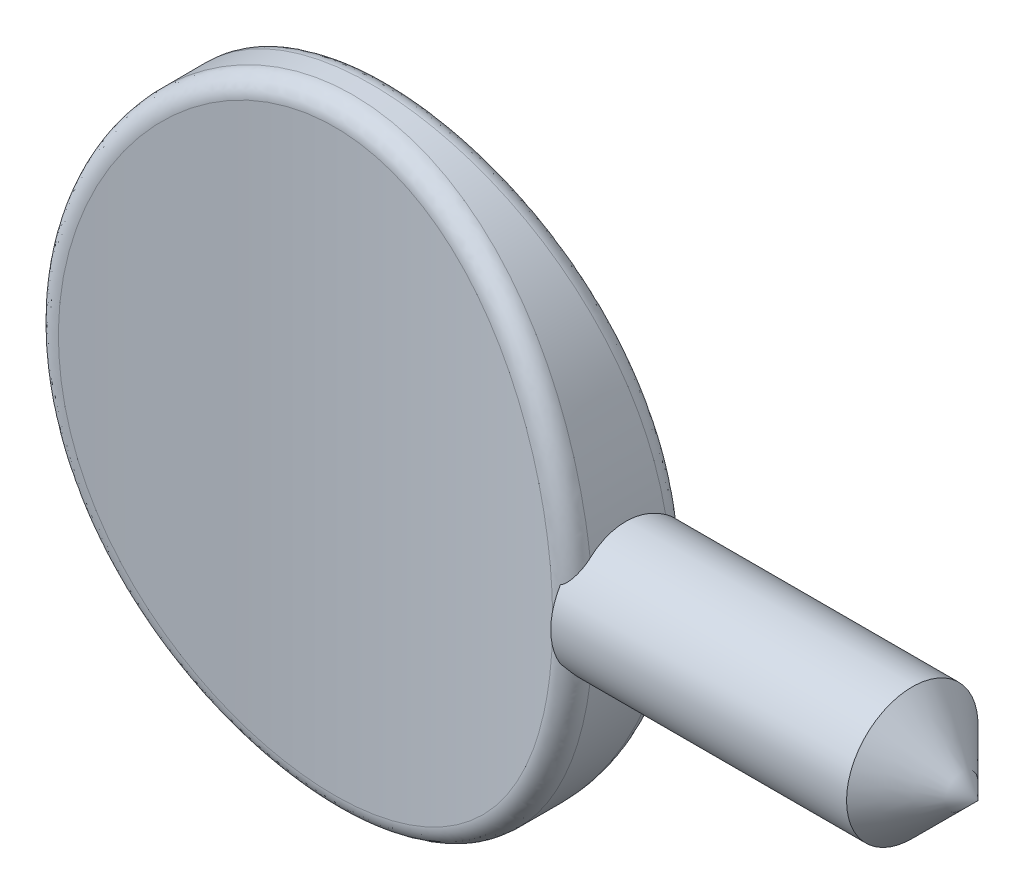
from build123d import *

# Parameters (mm, degrees)
SKETCH1_RX              = 11.303
SKETCH1_RY              = 9.906
EXTRUDE1_DEPTH          = 2.286
CUT_EXTRUDE1_DEPTH      = 16.202382741
CUT_EXTRUDE1_DEPTH_BACK = 16.202382741
SKETCH2_OUTSIDE_W       = 27.892
SKETCH2_OUTSIDE_H       = 12.652
FILLET3_R               = 0.677333333


with BuildPart() as part:
    # Sketch1 → Extrude1 (new, symmetric)
    with BuildSketch(Plane.XY):
        with Locations(Location((0, 0), (0, 0, -90))):
            Ellipse(SKETCH1_RX, SKETCH1_RY)
    extrude(amount=EXTRUDE1_DEPTH, both=True)

    # Sketch2 outside → Cut-Extrude1 (cut, two sides: drawn at the far end of the back side and taken through both)
    with BuildSketch(Plane(origin=(0, 0, 0), x_dir=(1, 0, 0), z_dir=(0, 1, 0)).offset(-CUT_EXTRUDE1_DEPTH_BACK)):
        Rectangle(SKETCH2_OUTSIDE_W, SKETCH2_OUTSIDE_H)
        with BuildLine():
            Line((-9.906, 2.286), (-9.906, -2.286))
            ThreePointArc((-9.906, -2.286), (0, -1.016), (9.906, -2.286))
            Line((9.906, -2.286), (9.906, 2.286))
            ThreePointArc((9.906, 2.286), (0, 1.016), (-9.906, 2.286))
        make_face(mode=Mode.SUBTRACT)
    extrude(amount=CUT_EXTRUDE1_DEPTH + CUT_EXTRUDE1_DEPTH_BACK, mode=Mode.SUBTRACT)

    # Fillet3
    fillet3_edges = [part.edges().sort_by_distance(p)[0] for p in [
        (-7.228513924, -7.728494619, 1.687044844),
        (3.75e-07, 11.303, -1.016),
    ]]
    fillet(fillet3_edges, radius=FILLET3_R)

    # Sketch3 → Revolve1 (revolve)
    with BuildSketch(Plane(origin=(0, 0, 0), x_dir=(1, 0, 0), z_dir=(0, 1, 0))):
        with BuildLine():
            Line((20.193, 2.413), (22.606, 0))
            Line((22.606, 0), (9.072182281, 0))
            Line((9.072182281, 0), (9.072182281, 2.078343579))
            ThreePointArc((9.072182281, 2.078343579), (9.262571156, 2.199720149), (9.336678517, 2.413))
            Line((9.336678517, 2.413), (13.208, 2.413))
            Line((13.208, 2.413), (20.193, 2.413))
        make_face()
    revolve(axis=Axis((0, 0, 0), (1, 0, 0)))


solid = part.part
